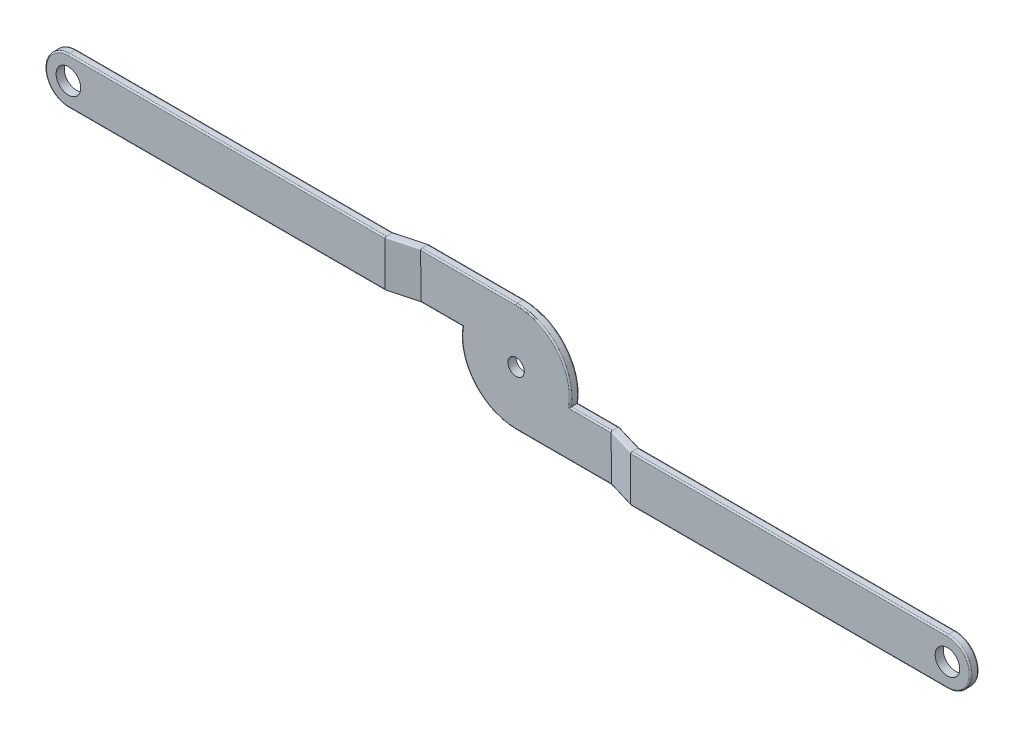
from build123d import *

# Parameters (mm, degrees)
SKETCH1_R             = 1.5
BOSS_EXTRUDE1_DEPTH   = 1.5
SKETCH2_R             = 2.25
BOSS_EXTRUDE2_DEPTH   = 1.5
BOSS_EXTRUDE2_2_DEPTH = 1.5
FILLET12_R            = 0.25
FILLET13_R            = 0.25
FILLET14_R            = 0.25


with BuildPart() as part:
    # Sketch1 → Boss-Extrude1 (new body)
    with BuildSketch(Plane.XY):
        with BuildLine():
            Line((-17.5, 10), (-17.386859967, 1.5))
            Line((-17.386859967, 1.5), (-9.886859967, 1.5))
            ThreePointArc((-9.886859967, 1.5), (-7.582875444, -6.519202405), (0, -10))
            Line((0, -10), (17.5, -10))
            Line((17.5, -10), (17.386859967, -1.5))
            Line((17.386859967, -1.5), (9.886859967, -1.5))
            ThreePointArc((9.886859967, -1.5), (7.582875444, 6.519202405), (0, 10))
            Line((0, 10), (-17.5, 10))
        make_face()
        Circle(SKETCH1_R, mode=Mode.SUBTRACT)
    extrude(amount=-BOSS_EXTRUDE1_DEPTH)

    # Fillet13
    fillet13_edges = [part.edges().sort_by_distance(p)[0] for p in [
        (13.636859967, -1.5, 0),
        (-8.75, 10, -1.5),
        (8.75, -10, 0),
        (-7.582875444, -6.519202405, 0),
        (-13.636859967, 1.5, 0),
        (-8.75, 10, 0),
        (7.582875444, 6.519202405, 0),
        (-13.636859967, 1.5, -1.5),
        (-7.582875444, -6.519202405, -1.5),
        (8.75, -10, -1.5),
        (13.636859967, -1.5, -1.5),
        (7.582875444, 6.519202405, -1.5),
    ]]
    fillet(fillet13_edges, radius=FILLET13_R)



with BuildPart() as body_2:
    # Sketch2 → Boss-Extrude2 (new body)
    with BuildSketch(Plane.XY):
        with BuildLine():
            Line((22.5, -1.520409702), (80.5, -1.520409702))
            ThreePointArc((80.5, -1.520409702), (84.75, -5.770409702), (80.5, -10.020409702))
            Line((80.5, -10.020409702), (22.5, -10.020409702))
            Line((22.5, -10.020409702), (22.5, -1.520409702))
        make_face()
        with Locations((80.5, -5.770409702)):
            Circle(SKETCH2_R, mode=Mode.SUBTRACT)
    extrude(amount=BOSS_EXTRUDE2_DEPTH)

    # Fillet12
    fillet12_edges = [body_2.edges().sort_by_distance(p)[0] for p in [
        (84.75, -5.770409702, 1.5),
        (51.5, -1.520409702, 1.5),
        (51.5, -1.520409702, 0),
        (84.75, -5.770409702, 0),
        (51.5, -10.020409702, 0),
        (51.5, -10.020409702, 1.5),
    ]]
    fillet(fillet12_edges, radius=FILLET12_R)


with BuildPart() as body_3:
    # Sketch2 → Boss-Extrude2 2 (new body)
    with BuildSketch(Plane.XY):
        with BuildLine():
            Line((-22.5, 10.120226545), (-80.5, 10.120226545))
            ThreePointArc((-80.5, 10.120226545), (-84.75, 5.870226545), (-80.5, 1.620226545))
            Line((-80.5, 1.620226545), (-22.5, 1.620226545))
            Line((-22.5, 1.620226545), (-22.5, 10.120226545))
        make_face()
        with Locations((-80.5, 5.870226545)):
            Circle(SKETCH2_R, mode=Mode.SUBTRACT)
    extrude(amount=BOSS_EXTRUDE2_2_DEPTH)

    # Fillet14
    fillet14_edges = [body_3.edges().sort_by_distance(p)[0] for p in [
        (-51.5, 10.120226545, 0),
        (-84.75, 5.870226545, 0),
        (-51.5, 1.620226545, 0),
        (-51.5, 10.120226545, 1.5),
        (-84.75, 5.870226545, 1.5),
        (-51.5, 1.620226545, 1.5),
    ]]
    fillet(fillet14_edges, radius=FILLET14_R)


with BuildPart() as part_1:
    add(part.part)

    add(body_2.part)  # loft3 joins it to this body
    # loft from a face of the part (loft3)
    loft([part_1.faces().sort_by_distance((17.443429983, -5.75, -0.75))[0], part_1.faces().sort_by_distance((22.5, -5.770409702, 0.75))[0]])


    add(body_3.part)  # loft4 joins it to this body
    # loft from a face of the part (loft4)
    loft([part_1.faces().sort_by_distance((-17.443429983, 5.75, -0.75))[0], part_1.faces().sort_by_distance((-22.5, 5.870226545, 0.75))[0]])


solid = part_1.part
